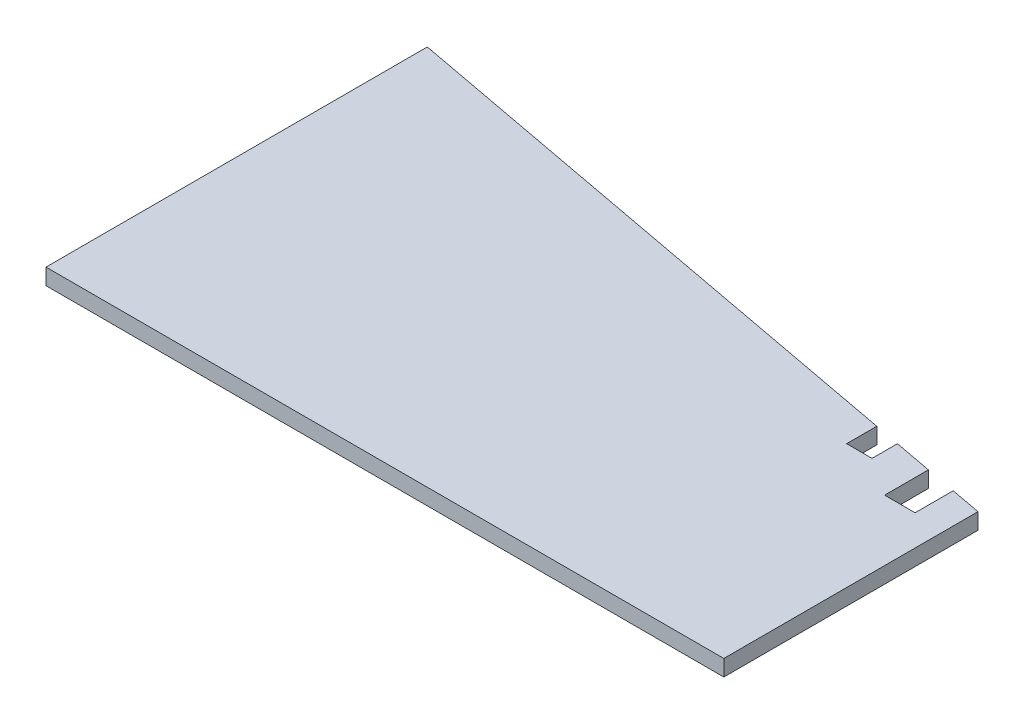
from build123d import *

# Parameters (mm, degrees)
BOSS_EXTRUDE1_DEPTH = 6.35


with BuildPart() as part:
    # Sketch2 → Boss-Extrude1 (new body)
    with BuildSketch(Plane(origin=(0, 0, 0), x_dir=(1, 0, 0), z_dir=(0, 1, 0))):
        Polygon((0, 0), (266.65, 0), (266.65, 100), (254.65, 102.250140634), (254.65, 87.250140634), (242.65, 87.250140634), (242.65, 104.500281268), (227.65, 107.31295706), (227.65, 97.31295706), (217.65, 97.31295706), (217.65, 109.188074255), (0, 150), align=None)
    extrude(amount=BOSS_EXTRUDE1_DEPTH)


solid = part.part
